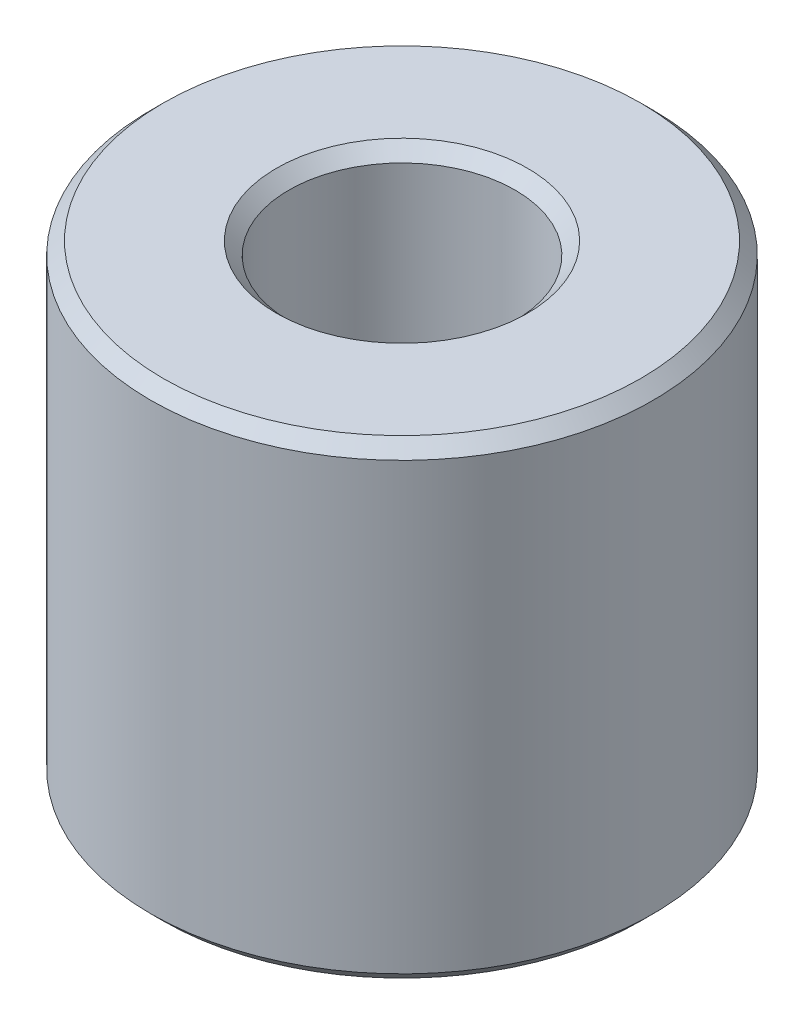
from build123d import *

# Parameters (mm, degrees)
SKETCH1_R     = 10
SKETCH1_R_2   = 4.5
BODY_DEPTH    = 18.7
CHAMFER1_SIZE = 0.5


with BuildPart() as part:
    # Sketch1 → Body (new body)
    with BuildSketch(Plane(origin=(0, 0, 0), x_dir=(1, 0, 0), z_dir=(0, 1, 0))):
        Circle(SKETCH1_R)
        Circle(SKETCH1_R_2, mode=Mode.SUBTRACT)
    extrude(amount=BODY_DEPTH)

    # Chamfer1
    chamfer1_edges = [part.edges().sort_by_distance(p)[0] for p in [
        (-4.5, 0, 0),
        (-10, 0, 0),
        (-10, 18.7, 0),
        (-4.5, 18.7, 0),
    ]]
    chamfer(chamfer1_edges, length=CHAMFER1_SIZE)


solid = part.part
